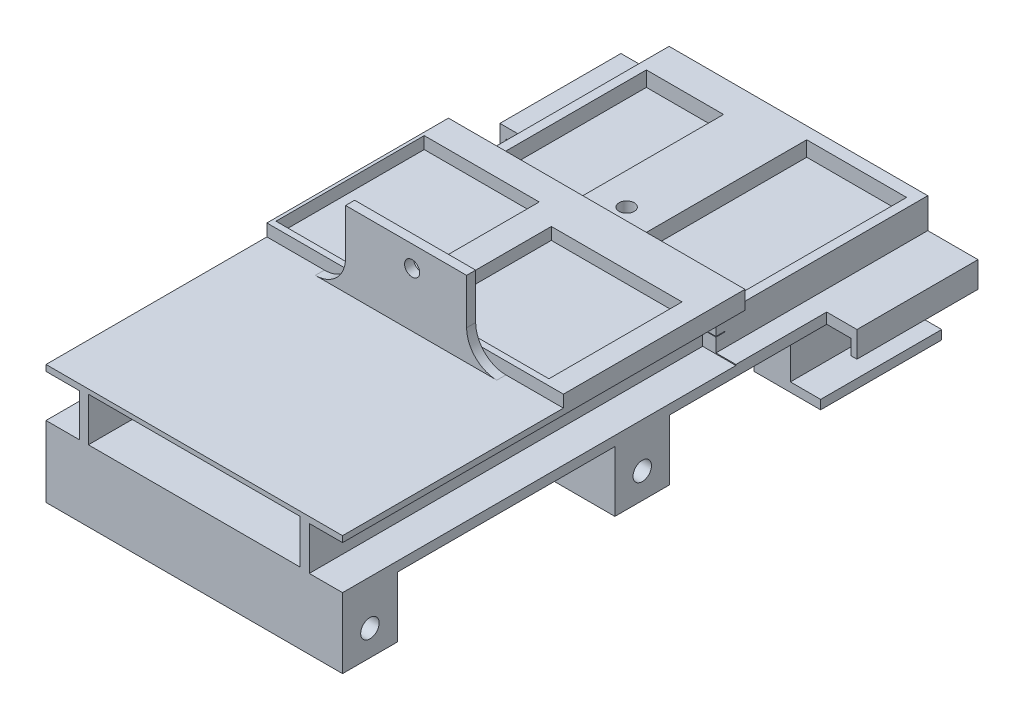
from build123d import *

# Parameters (mm, degrees)
SKETCH1_W            = 100
SKETCH1_H            = 200
BOSS_EXTRUDE3_DEPTH  = 20
SKETCH2_W            = 70
SKETCH2_H            = 14.5
CUT_EXTRUDE1_DEPTH   = 125
SKETCH3_W            = 100
SKETCH3_H            = 20
CUT_EXTRUDE2_DEPTH   = 50
SKETCH5_W            = 100
SKETCH5_H            = 20
CUT_EXTRUDE4_DEPTH   = 20
SKETCH6_W            = 12
SKETCH6_H            = 14.034071687
SKETCH6_H_2          = 14.310895683
CUT_EXTRUDE5_DEPTH   = 250
SKETCH7_W            = 40
SKETCH7_H            = 3
BOSS_EXTRUDE4_DEPTH  = 25
SKETCH8_R            = 2.5
CUT_EXTRUDE6_DEPTH   = 87.380637025
FILLET1_R            = 10
SKETCH9_W            = 100
SKETCH9_H            = 57.004619431
BOSS_EXTRUDE5_DEPTH  = 4
SKETCH10_W           = 38
SKETCH10_H           = 49
SKETCH10_W_2         = 43.2
SKETCH10_H_2         = 44
CUT_EXTRUDE7_DEPTH   = 4
SKETCH11_W           = 100
SKETCH11_H           = 24
BOSS_EXTRUDE6_DEPTH  = 70
SKETCH12_W           = 67
SKETCH12_H           = 10
SKETCH12_W_2         = 3
SKETCH12_H_2         = 0.213595458
CUT_EXTRUDE8_DEPTH   = 200
SKETCH13_W           = 25.5
SKETCH13_H           = 53.5
SKETCH13_W_2         = 33
SKETCH13_H_2         = 60
CUT_EXTRUDE9_DEPTH   = 5
SKETCH14_R           = 2.5
CUT_EXTRUDE10_DEPTH  = 200
SKETCH15_W           = 7.596730119
SKETCH15_H           = 64
SKETCH15_W_2         = 6.911895933
CUT_EXTRUDE11_DEPTH  = 10
SKETCH17_W           = 25
SKETCH17_H           = 40
BOSS_EXTRUDE7_DEPTH  = 25
CUT_EXTRUDE12_DEPTH  = 200
SKETCH20_W           = 18.078952058
SKETCH20_H           = 18.1
SKETCH20_W_2         = 19
BOSS_EXTRUDE9_DEPTH  = 20
SKETCH22_R           = 2.75
BOSS_EXTRUDE11_DEPTH = 30
BOSS_EXTRUDE12_START = 30
SKETCH24_R           = 2.75
BOSS_EXTRUDE12_DEPTH = 30
SKETCH25_R           = 2.75
CUT_EXTRUDE13_DEPTH  = 200
SKETCH28_R           = 3.2
BOSS_EXTRUDE13_DEPTH = 1
BOSS_EXTRUDE14_START = 1
SKETCH29_R           = 3.2
BOSS_EXTRUDE14_DEPTH = 1
CUT_EXTRUDE14_START  = -10
CUT_EXTRUDE14_DEPTH  = 10
CUT_EXTRUDE15_START  = -10
CUT_EXTRUDE15_DEPTH  = 10
CUT_EXTRUDE16_DEPTH  = 10
CUT_EXTRUDE17_DEPTH  = 10
CUT_EXTRUDE18_START  = -20
CUT_EXTRUDE18_DEPTH  = 20
CUT_EXTRUDE19_START  = -20
CUT_EXTRUDE19_DEPTH  = 20
CUT_EXTRUDE20_DEPTH  = 20
SKETCH33_3_W         = 10.940707505
SKETCH33_3_H         = 1
SKETCH33_3_W_2       = 1
SKETCH33_3_H_2       = 10.900777915
CUT_EXTRUDE21_DEPTH  = 20
SKETCH34_W           = 180.340414302
SKETCH34_H           = 57.124875553
CUT_EXTRUDE22_DEPTH  = 10
SKETCH35_W           = 132.181326392
SKETCH35_H           = 32.651532644
CUT_EXTRUDE23_DEPTH  = 10
SKETCH37_R           = 3.2
BOSS_EXTRUDE15_DEPTH = 1
BOSS_EXTRUDE16_START = 1
SKETCH38_R           = 3.2
BOSS_EXTRUDE16_DEPTH = 1
SKETCH39_R           = 3.2
BOSS_EXTRUDE17_DEPTH = 1
BOSS_EXTRUDE18_START = 1
SKETCH40_R           = 3.2
BOSS_EXTRUDE18_DEPTH = 1
BOSS_EXTRUDE19_START = -1
SKETCH41_R           = 3.2
BOSS_EXTRUDE19_DEPTH = 1
SKETCH42_R           = 3.2
BOSS_EXTRUDE20_DEPTH = 1
BOSS_EXTRUDE21_START = -1
SKETCH43_R           = 3.2
BOSS_EXTRUDE21_DEPTH = 1
SKETCH44_R           = 3.2
BOSS_EXTRUDE22_DEPTH = 1
CUT_EXTRUDE24_DEPTH  = 15
CUT_EXTRUDE25_START  = -15
CUT_EXTRUDE25_DEPTH  = 15
CUT_EXTRUDE26_DEPTH  = 15
CUT_EXTRUDE27_START  = -15
CUT_EXTRUDE27_DEPTH  = 15
CUT_EXTRUDE28_DEPTH  = 400
SKETCH46_W           = 9.182074762
SKETCH46_H           = 21.108102225
CUT_EXTRUDE29_DEPTH  = 400
CUT_EXTRUDE30_DEPTH  = 400
SKETCH48_W           = 8.181990046
SKETCH48_H           = 24
CUT_EXTRUDE31_DEPTH  = 400
SKETCH49_W           = 18.1
SKETCH49_H           = 19.5
BOSS_EXTRUDE23_DEPTH = 70
SKETCH50_W           = 18.1
SKETCH50_H           = 19.5
BOSS_EXTRUDE24_DEPTH = 70
SKETCH51_W           = 41.496758233
SKETCH51_H           = 38.038429699
CUT_EXTRUDE32_DEPTH  = 70
SKETCH52_W           = 47.487941889
SKETCH52_H           = 39.498413531
CUT_EXTRUDE33_DEPTH  = 70
SKETCH54_W           = 40
SKETCH54_H           = 25.5
BOSS_EXTRUDE25_DEPTH = 7
SKETCH56_R           = 3.218818865
CUT_EXTRUDE34_DEPTH  = 70
SKETCH57_W           = 40
SKETCH57_H           = 25.5
BOSS_EXTRUDE26_DEPTH = 7
CUT_EXTRUDE35_START  = 90
SKETCH58_R           = 3.218818865
CUT_EXTRUDE35_DEPTH  = 90
SKETCH61_R           = 3.05
CUT_EXTRUDE36_DEPTH  = 150
SKETCH62_W           = 40
SKETCH62_H           = 3.5
BOSS_EXTRUDE27_DEPTH = 10
SKETCH64_W           = 40
SKETCH64_H           = 3.5
BOSS_EXTRUDE28_DEPTH = 10
SKETCH65_W           = 2
SKETCH65_H           = 40
BOSS_EXTRUDE29_DEPTH = 5
SKETCH66_W           = 40
SKETCH66_H           = 3
BOSS_EXTRUDE30_DEPTH = 10
SKETCH67_W           = 40
SKETCH67_H           = 3
BOSS_EXTRUDE31_DEPTH = 10
SKETCH68_W           = 6.596730119
SKETCH68_H           = 10
SKETCH68_W_2         = 5.911895933
CUT_EXTRUDE37_DEPTH  = 10
SKETCH69_W           = 6.596730119
SKETCH69_H           = 4
SKETCH69_W_2         = 5.911895933
CUT_EXTRUDE38_DEPTH  = 10


with BuildPart() as part:
    # Sketch1 → Boss-Extrude3 (new body)
    with BuildSketch(Plane(origin=(0, 0, 0), x_dir=(1, 0, 0), z_dir=(0, 1, 0))):
        with Locations((-1.95035461, 21.453900709)):
            Rectangle(SKETCH1_W, SKETCH1_H)
    extrude(amount=BOSS_EXTRUDE3_DEPTH)

    # Sketch2 → Cut-Extrude1 (cut)
    with BuildSketch(Plane.XY.offset(78.546099291)):
        with Locations((-1.95035461, 11.25)):
            Rectangle(SKETCH2_W, SKETCH2_H)
    extrude(amount=-CUT_EXTRUDE1_DEPTH, mode=Mode.SUBTRACT)

    # Sketch3 → Cut-Extrude2 (cut)
    with BuildSketch(Plane(origin=(0, 0, -121.453900709), x_dir=(-1, 0, 0), z_dir=(0, 0, -1))):
        with Locations((1.95035461, 10)):
            Rectangle(SKETCH3_W, SKETCH3_H)
    extrude(amount=-CUT_EXTRUDE2_DEPTH, mode=Mode.SUBTRACT)

    # Sketch5 → Cut-Extrude4 (cut)
    with BuildSketch(Plane(origin=(0, 0, -71.453900709), x_dir=(-1, 0, 0), z_dir=(0, 0, -1))):
        with Locations((1.95035461, 10)):
            Rectangle(SKETCH5_W, SKETCH5_H)
    extrude(amount=-CUT_EXTRUDE4_DEPTH, mode=Mode.SUBTRACT)

    # Sketch6 → Cut-Extrude5 (cut)
    with BuildSketch(Plane.XY.offset(78.546099291)):
        with Locations((-45.95035461, 10.982964156)):
            Rectangle(SKETCH6_W, SKETCH6_H)
        with Locations((42.04964539, 10.844552159)):
            Rectangle(SKETCH6_W, SKETCH6_H_2)
    extrude(amount=-CUT_EXTRUDE5_DEPTH, mode=Mode.SUBTRACT)

    # Sketch7 → Boss-Extrude4 (add)
    with BuildSketch(Plane(origin=(0, 20, 0), x_dir=(1, 0, 0), z_dir=(0, 1, 0))):
        with Locations((-1.95035461, -7.046099291)):
            Rectangle(SKETCH7_W, SKETCH7_H)
    extrude(amount=BOSS_EXTRUDE4_DEPTH)

    # Sketch8 → Cut-Extrude6 (cut)
    with BuildSketch(Plane(origin=(0, 0, 5.546099291), x_dir=(-1, 0, 0), z_dir=(0, 0, -1))):
        with Locations((-0.04964539, 38)):
            Circle(SKETCH8_R)
    extrude(amount=-CUT_EXTRUDE6_DEPTH, mode=Mode.SUBTRACT)

    # Fillet1
    fillet1_edges = [part.edges().sort_by_distance(p)[0] for p in [
        (18.04964539, 20, 7.046099291),
        (-21.95035461, 20, 7.046099291),
    ]]
    fillet(fillet1_edges, radius=FILLET1_R)

    # Sketch9 → Boss-Extrude5 (add)
    with BuildSketch(Plane(origin=(0, 20, 0), x_dir=(1, 0, 0), z_dir=(0, 1, 0))):
        with Locations((-1.95035461, 22.951590994)):
            Rectangle(SKETCH9_W, SKETCH9_H)
    extrude(amount=BOSS_EXTRUDE5_DEPTH)

    # Sketch10 → Cut-Extrude7 (cut)
    with BuildSketch(Plane(origin=(0, 24, 0), x_dir=(1, 0, 0), z_dir=(0, 1, 0))):
        with Locations((-30.95035461, 20.949281278)):
            Rectangle(SKETCH10_W, SKETCH10_H)
        with Locations((18.64964539, 18.449281278)):
            Rectangle(SKETCH10_W_2, SKETCH10_H_2)
    extrude(amount=-CUT_EXTRUDE7_DEPTH, mode=Mode.SUBTRACT)

    # Sketch11 → Boss-Extrude6 (add)
    with BuildSketch(Plane(origin=(0, 0, -51.453900709), x_dir=(-1, 0, 0), z_dir=(0, 0, -1))):
        with Locations((1.95035461, 12)):
            Rectangle(SKETCH11_W, SKETCH11_H)
    extrude(amount=BOSS_EXTRUDE6_DEPTH)

    # Sketch12 → Cut-Extrude8 (cut)
    with BuildSketch(Plane.ZY.offset(51.95035461)):
        with Locations((-87.953900709, 19)):
            Rectangle(SKETCH12_W, SKETCH12_H)
        with Locations((-52.953900709, 8.616295233)):
            Rectangle(SKETCH12_W_2, SKETCH12_H_2)
    extrude(amount=-CUT_EXTRUDE8_DEPTH, mode=Mode.SUBTRACT)

    # Sketch13 → Cut-Extrude9 (cut)
    with BuildSketch(Plane(origin=(0, 14, 0), x_dir=(1, 0, 0), z_dir=(0, 1, 0))):
        with Locations((-29.288458677, 84.203900709)):
            Rectangle(SKETCH13_W, SKETCH13_H)
        with Locations((20.952915271, 87.453900709)):
            Rectangle(SKETCH13_W_2, SKETCH13_H_2)
    extrude(amount=-CUT_EXTRUDE9_DEPTH, mode=Mode.SUBTRACT)

    # Sketch14 → Cut-Extrude10 (cut)
    with BuildSketch(Plane(origin=(0, 14, 0), x_dir=(1, 0, 0), z_dir=(0, 1, 0))):
        with Locations((-6.047084729, 68.439210078)):
            Circle(SKETCH14_R)
    extrude(amount=-CUT_EXTRUDE10_DEPTH, mode=Mode.SUBTRACT)

    # Sketch15 → Cut-Extrude11 (cut)
    with BuildSketch(Plane(origin=(0, 14, 0), x_dir=(1, 0, 0), z_dir=(0, 1, 0))):
        with Locations((44.251280331, 89.453900709)):
            Rectangle(SKETCH15_W, SKETCH15_H)
        with Locations((-48.494406643, 89.453900709)):
            Rectangle(SKETCH15_W_2, SKETCH15_H)
    extrude(amount=-CUT_EXTRUDE11_DEPTH, mode=Mode.SUBTRACT)

    # Sketch17 → Boss-Extrude7 (add)
    with BuildSketch(Plane.XZ):
        with Locations((-39.45035461, -101.453900709)):
            Rectangle(SKETCH17_W, SKETCH17_H)
        with Locations((35.54964539, -101.453900709)):
            Rectangle(SKETCH17_W, SKETCH17_H)
    extrude(amount=BOSS_EXTRUDE7_DEPTH)

    # Sketch18 → Cut-Extrude12 (cut)
    with BuildSketch(Plane(origin=(0, 0, -121.453900709), x_dir=(-1, 0, 0), z_dir=(0, 0, -1))):
        Polygon((-28.04964539, 0.5), (-47.04964539, 0.5), (-47.04964539, -2.5), (-48.04964539, -2.5), (-48.04964539, -19), (-47.04964539, -19), (-47.04964539, -22), (-28.04964539, -22), align=None)
        Polygon((50.95035461, 0.5), (32.871402552, 0.5), (32.871402552, -22), (50.95035461, -22), (50.95035461, -19), (51.95035461, -19), (51.95035461, -2.5), (50.95035461, -2.5), align=None)
    extrude(amount=-CUT_EXTRUDE12_DEPTH, mode=Mode.SUBTRACT)

    # Sketch20 → Boss-Extrude9 (add)
    with BuildSketch(Plane.XZ.offset(-0.5)):
        with Locations((-41.910878581, 69.496099291)):
            Rectangle(SKETCH20_W, SKETCH20_H)
        with Locations((-41.910878581, -20.503900709)):
            Rectangle(SKETCH20_W, SKETCH20_H)
        with Locations((37.54964539, 69.496099291)):
            Rectangle(SKETCH20_W_2, SKETCH20_H)
        with Locations((37.54964539, -20.503900709)):
            Rectangle(SKETCH20_W_2, SKETCH20_H)
    extrude(amount=BOSS_EXTRUDE9_DEPTH)

    # Sketch22 → Boss-Extrude11 (add)
    with BuildSketch(Plane.ZY.offset(50.95035461)):
        with Locations((-20.503900709, -11.5)):
            Circle(SKETCH22_R)
        with Locations((69.496099291, -11.5)):
            Circle(SKETCH22_R)
    extrude(amount=BOSS_EXTRUDE11_DEPTH)

    # Sketch24 → Boss-Extrude12 (add)
    with BuildSketch(Plane(origin=(47.04964539, 0, 0), x_dir=(0, 0, -1), z_dir=(1, 0, 0)).offset(BOSS_EXTRUDE12_START)):
        with Locations((20.503900709, -11.5)):
            Circle(SKETCH24_R)
        with Locations((-69.496099291, -11.5)):
            Circle(SKETCH24_R)
    extrude(amount=-BOSS_EXTRUDE12_DEPTH)

    # Sketch25 → Cut-Extrude13 (cut)
    with BuildSketch(Plane.ZY.offset(32.871402552)):
        with Locations((-109.953900709, -11)):
            Circle(SKETCH25_R)
    extrude(amount=-CUT_EXTRUDE13_DEPTH, mode=Mode.SUBTRACT)

    # Sketch28 → Boss-Extrude13 (add)
    with BuildSketch(Plane.ZY.offset(80.95035461)):
        with Locations((-20.503900709, -11.5)):
            Circle(SKETCH28_R)
        with Locations((69.496099291, -11.5)):
            Circle(SKETCH28_R)
    extrude(amount=BOSS_EXTRUDE13_DEPTH)

    # Sketch29 → Boss-Extrude14 (add)
    with BuildSketch(Plane(origin=(77.04964539, 0, 0), x_dir=(0, 0, -1), z_dir=(1, 0, 0)).offset(BOSS_EXTRUDE14_START)):
        with Locations((20.503900709, -11.5)):
            Circle(SKETCH29_R)
        with Locations((-69.496099291, -11.5)):
            Circle(SKETCH29_R)
    extrude(amount=-BOSS_EXTRUDE14_DEPTH)

    # Sketch30 → Cut-Extrude14 (cut)
    with BuildSketch(Plane.ZY.offset(81.95035461).offset(CUT_EXTRUDE14_START)):
        with BuildLine():
            Line((-21.003900709, -11), (-23.664596835, -11))
            ThreePointArc((-23.664596835, -11), (-23.703900709, -11.5), (-23.664596835, -12))
            Line((-23.664596835, -12), (-21.003900709, -12))
            Line((-21.003900709, -12), (-21.003900709, -16.367500863))
            Line((-21.003900709, -16.367500863), (-20.003900709, -16.367500863))
            Line((-20.003900709, -16.367500863), (-20.003900709, -12))
            Line((-20.003900709, -12), (-17.343204583, -12))
            ThreePointArc((-17.343204583, -12), (-17.303900709, -11.5), (-17.343204583, -11))
            Line((-17.343204583, -11), (-20.003900709, -11))
            Line((-20.003900709, -11), (-20.003900709, -6.225385147))
            Line((-20.003900709, -6.225385147), (-21.003900709, -6.225385147))
            Line((-21.003900709, -6.225385147), (-21.003900709, -11))
        make_face()
    extrude(amount=CUT_EXTRUDE14_DEPTH, mode=Mode.SUBTRACT)

    # Sketch31 → Cut-Extrude15 (cut)
    with BuildSketch(Plane.ZY.offset(81.95035461).offset(CUT_EXTRUDE15_START)):
        with BuildLine():
            Line((68.996099291, -11), (66.335403165, -11))
            ThreePointArc((66.335403165, -11), (66.296099291, -11.5), (66.335403165, -12))
            Line((66.335403165, -12), (68.996099291, -12))
            Line((68.996099291, -12), (68.996099291, -14.660696126))
            ThreePointArc((68.996099291, -14.660696126), (69.496099291, -14.7), (69.996099291, -14.660696126))
            Line((69.996099291, -14.660696126), (69.996099291, -12))
            Line((69.996099291, -12), (72.656795417, -12))
            ThreePointArc((72.656795417, -12), (72.696099291, -11.5), (72.656795417, -11))
            Line((72.656795417, -11), (69.996099291, -11))
            Line((69.996099291, -11), (69.996099291, -4.651833728))
            Line((69.996099291, -4.651833728), (68.996099291, -4.651833728))
            Line((68.996099291, -4.651833728), (68.996099291, -11))
        make_face()
    extrude(amount=CUT_EXTRUDE15_DEPTH, mode=Mode.SUBTRACT)

    # Sketch32 → Cut-Extrude16 (cut)
    with BuildSketch(Plane(origin=(78.04964539, 0, 0), x_dir=(0, 0, -1), z_dir=(1, 0, 0))):
        with BuildLine():
            Line((-69.996099291, -11), (-72.656795417, -11))
            ThreePointArc((-72.656795417, -11), (-72.696099291, -11.5), (-72.656795417, -12))
            Line((-72.656795417, -12), (-69.996099291, -12))
            Line((-69.996099291, -12), (-69.996099291, -14.660696126))
            ThreePointArc((-69.996099291, -14.660696126), (-69.496099291, -14.7), (-68.996099291, -14.660696126))
            Line((-68.996099291, -14.660696126), (-68.996099291, -12))
            Line((-68.996099291, -12), (-66.335403165, -12))
            ThreePointArc((-66.335403165, -12), (-66.296099291, -11.5), (-66.335403165, -11))
            Line((-66.335403165, -11), (-68.996099291, -11))
            Line((-68.996099291, -11), (-68.996099291, -8.339303874))
            ThreePointArc((-68.996099291, -8.339303874), (-69.496099291, -8.3), (-69.996099291, -8.339303874))
            Line((-69.996099291, -8.339303874), (-69.996099291, -11))
        make_face()
    extrude(amount=-CUT_EXTRUDE16_DEPTH, mode=Mode.SUBTRACT)

    # Sketch33 → Cut-Extrude17 (cut)
    with BuildSketch(Plane(origin=(78.04964539, 0, 0), x_dir=(0, 0, -1), z_dir=(1, 0, 0))):
        with BuildLine():
            Line((20.003900709, -11), (17.343204583, -11))
            ThreePointArc((17.343204583, -11), (17.303900709, -11.5), (17.343204583, -12))
            Line((17.343204583, -12), (20.003900709, -12))
            Line((20.003900709, -12), (20.003900709, -14.660696126))
            ThreePointArc((20.003900709, -14.660696126), (20.503900709, -14.7), (21.003900709, -14.660696126))
            Line((21.003900709, -14.660696126), (21.003900709, -12))
            Line((21.003900709, -12), (23.664596835, -12))
            ThreePointArc((23.664596835, -12), (23.703900709, -11.5), (23.664596835, -11))
            Line((23.664596835, -11), (21.003900709, -11))
            Line((21.003900709, -11), (21.003900709, -8.339303874))
            ThreePointArc((21.003900709, -8.339303874), (20.503900709, -8.3), (20.003900709, -8.339303874))
            Line((20.003900709, -8.339303874), (20.003900709, -11))
        make_face()
    extrude(amount=-CUT_EXTRUDE17_DEPTH, mode=Mode.SUBTRACT)

    # Sketch31<3> → Cut-Extrude18 (cut)
    with BuildSketch(Plane.ZY.offset(81.95035461).offset(CUT_EXTRUDE18_START)):
        with BuildLine():
            Line((68.996099291, -11), (66.335403165, -11))
            ThreePointArc((66.335403165, -11), (66.296099291, -11.5), (66.335403165, -12))
            Line((66.335403165, -12), (68.996099291, -12))
            Line((68.996099291, -12), (68.996099291, -17.113059999))
            Line((68.996099291, -17.113059999), (69.996099291, -17.113059999))
            Line((69.996099291, -17.113059999), (69.996099291, -12))
            Line((69.996099291, -12), (72.656795417, -12))
            ThreePointArc((72.656795417, -12), (72.696099291, -11.5), (72.656795417, -11))
            Line((72.656795417, -11), (69.996099291, -11))
            Line((69.996099291, -11), (69.996099291, -4.651833728))
            Line((69.996099291, -4.651833728), (68.996099291, -4.651833728))
            Line((68.996099291, -4.651833728), (68.996099291, -11))
        make_face()
    extrude(amount=CUT_EXTRUDE18_DEPTH, mode=Mode.SUBTRACT)

    # Sketch30<3> → Cut-Extrude19 (cut)
    with BuildSketch(Plane.ZY.offset(81.95035461).offset(CUT_EXTRUDE19_START)):
        with BuildLine():
            Line((-21.003900709, -11), (-23.664596835, -11))
            ThreePointArc((-23.664596835, -11), (-23.703900709, -11.5), (-23.664596835, -12))
            Line((-23.664596835, -12), (-21.003900709, -12))
            Line((-21.003900709, -12), (-21.003900709, -16.367500863))
            Line((-21.003900709, -16.367500863), (-20.003900709, -16.367500863))
            Line((-20.003900709, -16.367500863), (-20.003900709, -12))
            Line((-20.003900709, -12), (-17.343204583, -12))
            ThreePointArc((-17.343204583, -12), (-17.303900709, -11.5), (-17.343204583, -11))
            Line((-17.343204583, -11), (-20.003900709, -11))
            Line((-20.003900709, -11), (-20.003900709, -6.225385147))
            Line((-20.003900709, -6.225385147), (-21.003900709, -6.225385147))
            Line((-21.003900709, -6.225385147), (-21.003900709, -11))
        make_face()
    extrude(amount=CUT_EXTRUDE19_DEPTH, mode=Mode.SUBTRACT)

    # Sketch32<3> → Cut-Extrude20 (cut)
    with BuildSketch(Plane(origin=(78.04964539, 0, 0), x_dir=(0, 0, -1), z_dir=(1, 0, 0))):
        with BuildLine():
            Line((-69.996099291, -11), (-72.656795417, -11))
            ThreePointArc((-72.656795417, -11), (-72.696099291, -11.5), (-72.656795417, -12))
            Line((-72.656795417, -12), (-69.996099291, -12))
            Line((-69.996099291, -12), (-69.996099291, -17.314404142))
            Line((-69.996099291, -17.314404142), (-68.996099291, -17.314404142))
            Line((-68.996099291, -17.314404142), (-68.996099291, -12))
            Line((-68.996099291, -12), (-66.335403165, -12))
            ThreePointArc((-66.335403165, -12), (-66.296099291, -11.5), (-66.335403165, -11))
            Line((-66.335403165, -11), (-68.996099291, -11))
            Line((-68.996099291, -11), (-68.996099291, -5.258438686))
            Line((-68.996099291, -5.258438686), (-69.996099291, -5.258438686))
            Line((-69.996099291, -5.258438686), (-69.996099291, -11))
        make_face()
    extrude(amount=-CUT_EXTRUDE20_DEPTH, mode=Mode.SUBTRACT)

    # Sketch33<3> → Cut-Extrude21 (cut)
    with BuildSketch(Plane(origin=(78.04964539, 0, 0), x_dir=(0, 0, -1), z_dir=(1, 0, 0))):
        with Locations((20.949135981, -11.5)):
            Rectangle(SKETCH33_3_W, SKETCH33_3_H)
        with Locations((20.503900709, -11.687036442)):
            Rectangle(SKETCH33_3_W_2, SKETCH33_3_H_2)
    extrude(amount=-CUT_EXTRUDE21_DEPTH, mode=Mode.SUBTRACT)

    # Sketch34 → Cut-Extrude22 (cut)
    with BuildSketch(Plane.ZY.offset(81.95035461)):
        with Locations((25.808608437, -11.00555962)):
            Rectangle(SKETCH34_W, SKETCH34_H)
    extrude(amount=-CUT_EXTRUDE22_DEPTH, mode=Mode.SUBTRACT)

    # Sketch35 → Cut-Extrude23 (cut)
    with BuildSketch(Plane(origin=(78.04964539, 0, 0), x_dir=(0, 0, -1), z_dir=(1, 0, 0))):
        with Locations((-21.709962657, -16.325766322)):
            Rectangle(SKETCH35_W, SKETCH35_H)
    extrude(amount=-CUT_EXTRUDE23_DEPTH, mode=Mode.SUBTRACT)

    # Sketch37 → Boss-Extrude15 (add)
    with BuildSketch(Plane.ZY.offset(61.95035461)):
        with Locations((69.496099291, -11.5)):
            Circle(SKETCH37_R)
    extrude(amount=-BOSS_EXTRUDE15_DEPTH)

    # Sketch38 → Boss-Extrude16 (add)
    with BuildSketch(Plane.ZY.offset(71.95035461).offset(BOSS_EXTRUDE16_START)):
        with Locations((69.496099291, -11.5)):
            Circle(SKETCH38_R)
    extrude(amount=-BOSS_EXTRUDE16_DEPTH)

    # Sketch39 → Boss-Extrude17 (add)
    with BuildSketch(Plane.ZY.offset(61.95035461)):
        with Locations((-20.503900709, -11.5)):
            Circle(SKETCH39_R)
    extrude(amount=-BOSS_EXTRUDE17_DEPTH)

    # Sketch40 → Boss-Extrude18 (add)
    with BuildSketch(Plane.ZY.offset(71.95035461).offset(BOSS_EXTRUDE18_START)):
        with Locations((-20.503900709, -11.5)):
            Circle(SKETCH40_R)
    extrude(amount=-BOSS_EXTRUDE18_DEPTH)

    # Sketch41 → Boss-Extrude19 (add)
    with BuildSketch(Plane(origin=(58.04964539, 0, 0), x_dir=(0, 0, -1), z_dir=(1, 0, 0)).offset(BOSS_EXTRUDE19_START)):
        with Locations((-69.496099291, -11.5)):
            Circle(SKETCH41_R)
    extrude(amount=BOSS_EXTRUDE19_DEPTH)

    # Sketch42 → Boss-Extrude20 (add)
    with BuildSketch(Plane(origin=(68.04964539, 0, 0), x_dir=(0, 0, -1), z_dir=(1, 0, 0))):
        with Locations((-69.496099291, -11.5)):
            Circle(SKETCH42_R)
    extrude(amount=BOSS_EXTRUDE20_DEPTH)

    # Sketch43 → Boss-Extrude21 (add)
    with BuildSketch(Plane(origin=(58.04964539, 0, 0), x_dir=(0, 0, -1), z_dir=(1, 0, 0)).offset(BOSS_EXTRUDE21_START)):
        with Locations((20.503900709, -11.5)):
            Circle(SKETCH43_R)
    extrude(amount=BOSS_EXTRUDE21_DEPTH)

    # Sketch44 → Boss-Extrude22 (add)
    with BuildSketch(Plane(origin=(68.04964539, 0, 0), x_dir=(0, 0, -1), z_dir=(1, 0, 0))):
        with Locations((20.503900709, -11.5)):
            Circle(SKETCH44_R)
    extrude(amount=BOSS_EXTRUDE22_DEPTH)

    # Sketch30<5> → Cut-Extrude24 (cut)
    with BuildSketch(Plane.ZY.offset(81.95035461)):
        with BuildLine():
            Line((-25.149283716, -11), (-25.149283716, -12))
            Line((-25.149283716, -12), (-21.003900709, -12))
            Line((-21.003900709, -12), (-21.003900709, -14.660696126))
            ThreePointArc((-21.003900709, -14.660696126), (-20.503900709, -14.7), (-20.003900709, -14.660696126))
            Line((-20.003900709, -14.660696126), (-20.003900709, -12))
            Line((-20.003900709, -12), (-15.366534305, -12))
            Line((-15.366534305, -12), (-15.366534305, -11))
            Line((-15.366534305, -11), (-20.003900709, -11))
            Line((-20.003900709, -11), (-20.003900709, -8.339303874))
            ThreePointArc((-20.003900709, -8.339303874), (-20.503900709, -8.3), (-21.003900709, -8.339303874))
            Line((-21.003900709, -8.339303874), (-21.003900709, -11))
            Line((-21.003900709, -11), (-25.149283716, -11))
        make_face()
    extrude(amount=-CUT_EXTRUDE24_DEPTH, mode=Mode.SUBTRACT)

    # Sketch33<4> → Cut-Extrude25 (cut)
    with BuildSketch(Plane(origin=(78.04964539, 0, 0), x_dir=(0, 0, -1), z_dir=(1, 0, 0)).offset(CUT_EXTRUDE25_START)):
        with BuildLine():
            Line((15.478782229, -11), (15.478782229, -12))
            Line((15.478782229, -12), (20.003900709, -12))
            Line((20.003900709, -12), (20.003900709, -14.660696126))
            ThreePointArc((20.003900709, -14.660696126), (20.503900709, -14.7), (21.003900709, -14.660696126))
            Line((21.003900709, -14.660696126), (21.003900709, -12))
            Line((21.003900709, -12), (26.419489734, -12))
            Line((26.419489734, -12), (26.419489734, -11))
            Line((26.419489734, -11), (21.003900709, -11))
            Line((21.003900709, -11), (21.003900709, -8.339303874))
            ThreePointArc((21.003900709, -8.339303874), (20.503900709, -8.3), (20.003900709, -8.339303874))
            Line((20.003900709, -8.339303874), (20.003900709, -11))
            Line((20.003900709, -11), (15.478782229, -11))
        make_face()
    extrude(amount=CUT_EXTRUDE25_DEPTH, mode=Mode.SUBTRACT)

    # Sketch31<4> → Cut-Extrude26 (cut)
    with BuildSketch(Plane.ZY.offset(81.95035461)):
        with BuildLine():
            Line((68.996099291, -11), (66.335403165, -11))
            ThreePointArc((66.335403165, -11), (66.296099291, -11.5), (66.335403165, -12))
            Line((66.335403165, -12), (68.996099291, -12))
            Line((68.996099291, -12), (68.996099291, -17.113059999))
            Line((68.996099291, -17.113059999), (69.996099291, -17.113059999))
            Line((69.996099291, -17.113059999), (69.996099291, -12))
            Line((69.996099291, -12), (72.656795417, -12))
            ThreePointArc((72.656795417, -12), (72.696099291, -11.5), (72.656795417, -11))
            Line((72.656795417, -11), (69.996099291, -11))
            Line((69.996099291, -11), (69.996099291, -4.651833728))
            Line((69.996099291, -4.651833728), (68.996099291, -4.651833728))
            Line((68.996099291, -4.651833728), (68.996099291, -11))
        make_face()
    extrude(amount=-CUT_EXTRUDE26_DEPTH, mode=Mode.SUBTRACT)

    # Sketch32<4> → Cut-Extrude27 (cut)
    with BuildSketch(Plane(origin=(78.04964539, 0, 0), x_dir=(0, 0, -1), z_dir=(1, 0, 0)).offset(CUT_EXTRUDE27_START)):
        with BuildLine():
            Line((-69.996099291, -11), (-72.656795417, -11))
            ThreePointArc((-72.656795417, -11), (-72.696099291, -11.5), (-72.656795417, -12))
            Line((-72.656795417, -12), (-69.996099291, -12))
            Line((-69.996099291, -12), (-69.996099291, -17.314404142))
            Line((-69.996099291, -17.314404142), (-68.996099291, -17.314404142))
            Line((-68.996099291, -17.314404142), (-68.996099291, -12))
            Line((-68.996099291, -12), (-66.335403165, -12))
            ThreePointArc((-66.335403165, -12), (-66.296099291, -11.5), (-66.335403165, -11))
            Line((-66.335403165, -11), (-68.996099291, -11))
            Line((-68.996099291, -11), (-68.996099291, -5.258438686))
            Line((-68.996099291, -5.258438686), (-69.996099291, -5.258438686))
            Line((-69.996099291, -5.258438686), (-69.996099291, -11))
        make_face()
    extrude(amount=CUT_EXTRUDE27_DEPTH, mode=Mode.SUBTRACT)

    # Sketch45 → Cut-Extrude28 (cut)
    with BuildSketch(Plane.XY.offset(78.546099291)):
        Polygon((47.04964539, -19), (73.648553801, -19), (73.648553801, 24.234406444), (47.04964539, 24.234406444), (47.04964539, 20), (48.04964539, 20), (48.04964539, 18), (47.04964539, 18), (47.04964539, 3.689104317), (48.04964539, 3.689104317), (48.04964539, 0), (47.04964539, 0), align=None)
    extrude(amount=-CUT_EXTRUDE28_DEPTH, mode=Mode.SUBTRACT)

    # Sketch46 → Cut-Extrude29 (cut)
    with BuildSketch(Plane.XY.offset(78.546099291)):
        with Locations((51.640682771, 9.445948888)):
            Rectangle(SKETCH46_W, SKETCH46_H)
    extrude(amount=-CUT_EXTRUDE29_DEPTH, mode=Mode.SUBTRACT)

    # Sketch47 → Cut-Extrude30 (cut)
    with BuildSketch(Plane.XY.offset(78.546099291)):
        Polygon((-50.95035461, -18.251983778), (-50.95035461, 0), (-51.95035461, 0), (-51.95035461, 3.965928313), (-50.95035461, 3.965928313), (-50.95035461, 18), (-51.95035461, 18), (-51.95035461, 20), (-50.95035461, 20), (-50.95035461, 34.698179198), (-87.439409032, 34.698179198), (-87.439409032, -18.251983778), align=None)
    extrude(amount=-CUT_EXTRUDE30_DEPTH, mode=Mode.SUBTRACT)

    # Sketch48 → Cut-Extrude31 (cut)
    with BuildSketch(Plane.XY.offset(78.546099291)):
        with Locations((-55.041349633, 12)):
            Rectangle(SKETCH48_W, SKETCH48_H)
    extrude(amount=-CUT_EXTRUDE31_DEPTH, mode=Mode.SUBTRACT)

    # Sketch49 → Boss-Extrude23 (add)
    with BuildSketch(Plane(origin=(-32.871402552, 0, 0), x_dir=(0, 0, -1), z_dir=(1, 0, 0))):
        with Locations((-69.496099291, -9.75)):
            Rectangle(SKETCH49_W, SKETCH49_H)
    extrude(amount=BOSS_EXTRUDE23_DEPTH)

    # Sketch50 → Boss-Extrude24 (add)
    with BuildSketch(Plane(origin=(-32.871402552, 0, 0), x_dir=(0, 0, -1), z_dir=(1, 0, 0))):
        with Locations((20.503900709, -9.75)):
            Rectangle(SKETCH50_W, SKETCH50_H)
    extrude(amount=BOSS_EXTRUDE24_DEPTH)

    # Sketch51 → Cut-Extrude32 (cut)
    with BuildSketch(Plane.ZY.offset(32.871402552)):
        with Locations((-100.705521593, -18.51921485)):
            Rectangle(SKETCH51_W, SKETCH51_H)
    extrude(amount=CUT_EXTRUDE32_DEPTH, mode=Mode.SUBTRACT)

    # Sketch52 → Cut-Extrude33 (cut)
    with BuildSketch(Plane(origin=(28.04964539, 0, 0), x_dir=(0, 0, -1), z_dir=(1, 0, 0))):
        with Locations((97.709929765, -19.249206766)):
            Rectangle(SKETCH52_W, SKETCH52_H)
    extrude(amount=CUT_EXTRUDE33_DEPTH, mode=Mode.SUBTRACT)

    # Sketch54 → Boss-Extrude25 (add)
    with BuildSketch(Plane.ZY.offset(32.871402552)):
        with Locations((-101.453900709, -12.25)):
            Rectangle(SKETCH54_W, SKETCH54_H)
    extrude(amount=BOSS_EXTRUDE25_DEPTH)

    # Sketch56 → Cut-Extrude34 (cut)
    with BuildSketch(Plane(origin=(-26.95035461, 0, 0), x_dir=(0, 0, -1), z_dir=(1, 0, 0))):
        with Locations((109.953900709, -11)):
            Circle(SKETCH56_R)
    extrude(amount=-CUT_EXTRUDE34_DEPTH, mode=Mode.SUBTRACT)

    # Sketch57 → Boss-Extrude26 (add)
    with BuildSketch(Plane(origin=(28.04964539, 0, 0), x_dir=(0, 0, -1), z_dir=(1, 0, 0))):
        with Locations((101.453900709, -12.25)):
            Rectangle(SKETCH57_W, SKETCH57_H)
    extrude(amount=BOSS_EXTRUDE26_DEPTH)

    # Sketch58 → Cut-Extrude35 (cut)
    with BuildSketch(Plane(origin=(-26.95035461, 0, 0), x_dir=(0, 0, -1), z_dir=(1, 0, 0)).offset(CUT_EXTRUDE35_START)):
        with Locations((109.953900709, -11)):
            Circle(SKETCH58_R)
    extrude(amount=-CUT_EXTRUDE35_DEPTH, mode=Mode.SUBTRACT)

    # Sketch61 → Cut-Extrude36 (cut)
    with BuildSketch(Plane.ZY.offset(50.95035461)):
        with Locations((-20.503900709, -11)):
            Circle(SKETCH61_R)
        with Locations((69.496099291, -11)):
            Circle(SKETCH61_R)
    extrude(amount=-CUT_EXTRUDE36_DEPTH, mode=Mode.SUBTRACT)

    # Sketch62 → Boss-Extrude27 (add)
    with BuildSketch(Plane.ZY.offset(50.95035461)):
        with Locations((-101.453900709, 2.25)):
            Rectangle(SKETCH62_W, SKETCH62_H)
    extrude(amount=BOSS_EXTRUDE27_DEPTH)

    # Sketch64 → Boss-Extrude28 (add)
    with BuildSketch(Plane(origin=(47.04964539, 0, 0), x_dir=(0, 0, -1), z_dir=(1, 0, 0))):
        with Locations((101.453900709, 2.25)):
            Rectangle(SKETCH64_W, SKETCH64_H)
    extrude(amount=BOSS_EXTRUDE28_DEPTH)

    # Sketch65 → Boss-Extrude29 (add)
    with BuildSketch(Plane.XZ.offset(-0.5)):
        with Locations((56.04964539, -101.453900709)):
            Rectangle(SKETCH65_W, SKETCH65_H)
        with Locations((-59.95035461, -101.453900709)):
            Rectangle(SKETCH65_W, SKETCH65_H)
    extrude(amount=BOSS_EXTRUDE29_DEPTH)

    # Sketch66 → Boss-Extrude30 (add)
    with BuildSketch(Plane(origin=(35.04964539, 0, 0), x_dir=(0, 0, -1), z_dir=(1, 0, 0))):
        with Locations((101.453900709, -23.5)):
            Rectangle(SKETCH66_W, SKETCH66_H)
    extrude(amount=BOSS_EXTRUDE30_DEPTH)

    # Sketch67 → Boss-Extrude31 (add)
    with BuildSketch(Plane.ZY.offset(39.871402552)):
        with Locations((-101.453900709, -23.5)):
            Rectangle(SKETCH67_W, SKETCH67_H)
    extrude(amount=BOSS_EXTRUDE31_DEPTH)

    # Sketch68 → Cut-Extrude37 (cut)
    with BuildSketch(Plane(origin=(0, 0, -57.453900709), x_dir=(-1, 0, 0), z_dir=(0, 0, -1))):
        with Locations((-43.751280331, 9)):
            Rectangle(SKETCH68_W, SKETCH68_H)
        with Locations((47.994406643, 9)):
            Rectangle(SKETCH68_W_2, SKETCH68_H)
    extrude(amount=-CUT_EXTRUDE37_DEPTH, mode=Mode.SUBTRACT)

    # Sketch69 → Cut-Extrude38 (cut)
    with BuildSketch(Plane.XY.offset(-51.453900709)):
        with Locations((43.751280331, 16)):
            Rectangle(SKETCH69_W, SKETCH69_H)
        with Locations((-47.994406643, 16)):
            Rectangle(SKETCH69_W_2, SKETCH69_H)
    extrude(amount=-CUT_EXTRUDE38_DEPTH, mode=Mode.SUBTRACT)


solid = part.part
